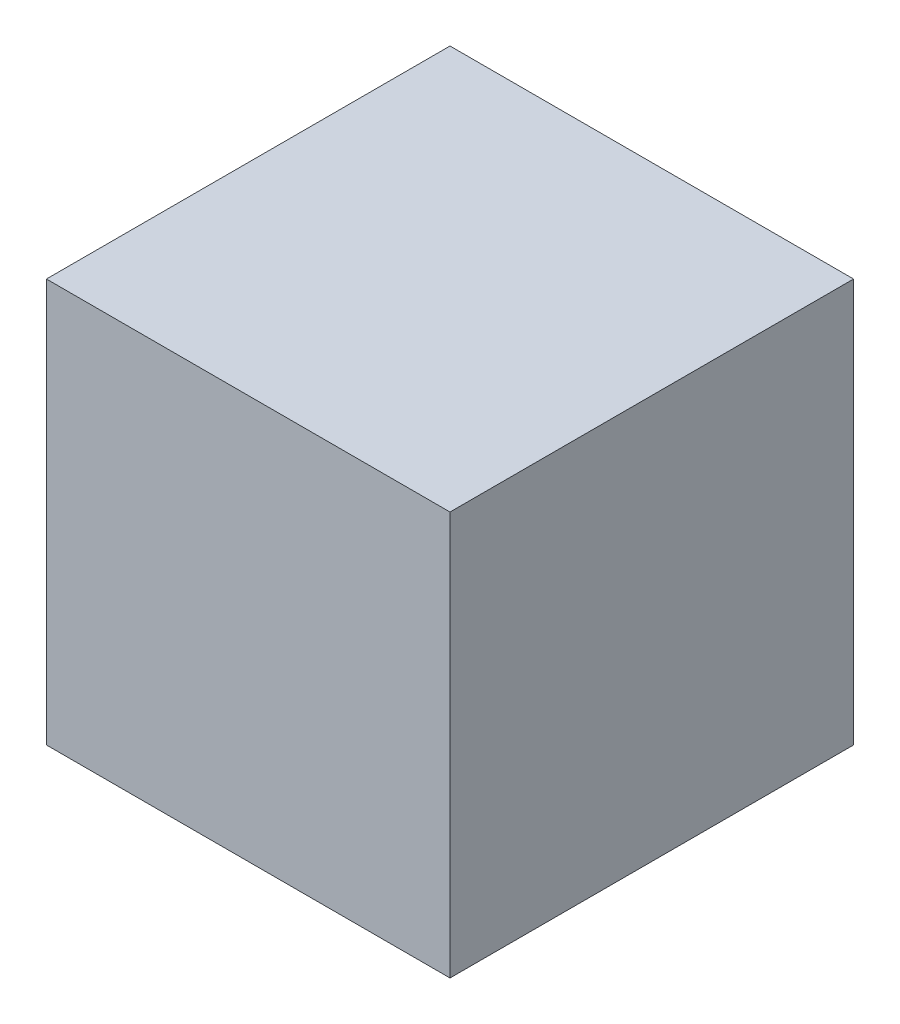
from build123d import *

# Parameters (mm, degrees)
SKETCH1_W           = 150
SKETCH1_H           = 150
BOSS_EXTRUDE1_DEPTH = 150


with BuildPart() as part:
    # Sketch1 → Boss-Extrude1 (new body)
    with BuildSketch(Plane(origin=(0, 0, 0), x_dir=(1, 0, 0), z_dir=(0, 1, 0))):
        with Locations((75, 75)):
            Rectangle(SKETCH1_W, SKETCH1_H)
    extrude(amount=BOSS_EXTRUDE1_DEPTH)


solid = part.part
